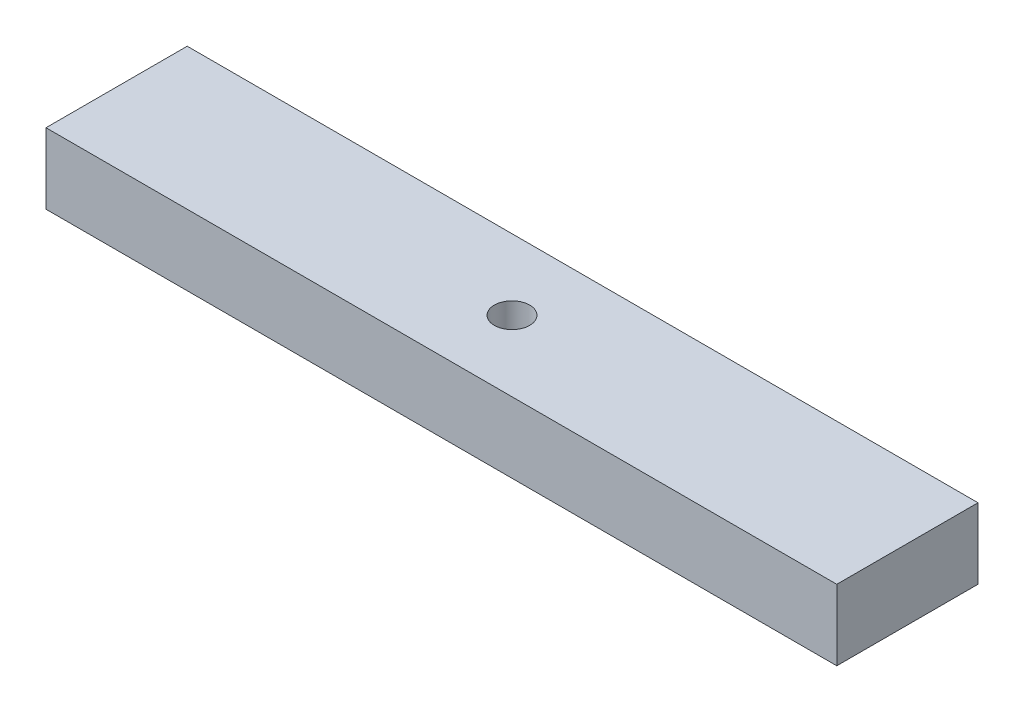
from build123d import *

# Parameters (mm, degrees)
SKETCH1_W           = 142.24
SKETCH1_H           = 25.4
SKETCH1_R           = 3.175
BOSS_EXTRUDE1_DEPTH = 12.7


with BuildPart() as part:
    # Sketch1 → Boss-Extrude1 (new body)
    with BuildSketch(Plane(origin=(0, 0, 0), x_dir=(1, 0, 0), z_dir=(0, 1, 0))):
        with Locations((71.12, 12.7)):
            Rectangle(SKETCH1_W, SKETCH1_H)
        with Locations((71.12, 12.7)):
            Circle(SKETCH1_R, mode=Mode.SUBTRACT)
    extrude(amount=BOSS_EXTRUDE1_DEPTH)


solid = part.part
